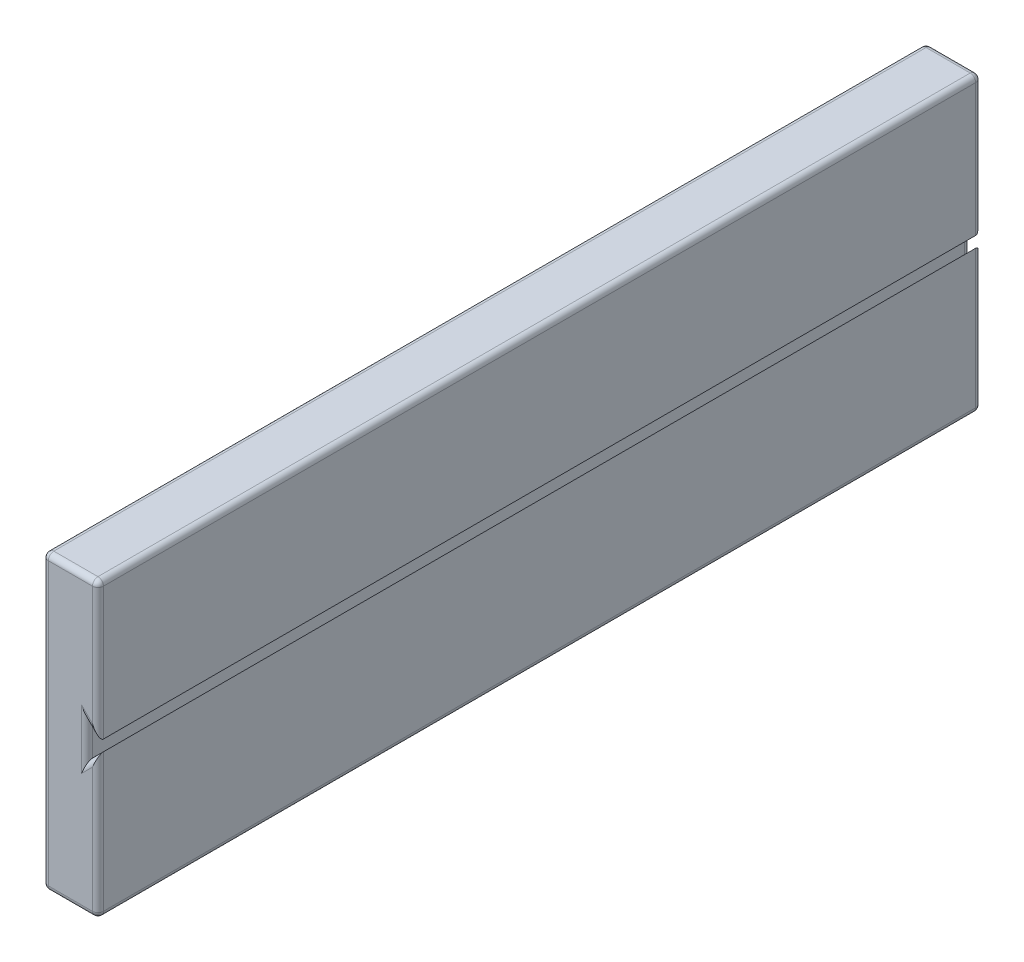
from build123d import *

# Parameters (mm, degrees)
SKETCH1_W               = 160
SKETCH1_H               = 53
BOSS_EXTRUDE1_DEPTH     = 10
CUT_EXTRUDE2_DEPTH      = 169.846083757
CUT_EXTRUDE2_DEPTH_BACK = 169.846083757
FILLET1_R               = 1


with BuildPart() as part:
    # Sketch1 → Boss-Extrude1 (new body)
    with BuildSketch(Plane(origin=(0, 0, 0), x_dir=(0, 0, -1), z_dir=(1, 0, 0))):
        with Locations((80, 26.5)):
            Rectangle(SKETCH1_W, SKETCH1_H)
    extrude(amount=BOSS_EXTRUDE1_DEPTH)

    # Sketch4 → Cut-Extrude2 (cut, two sides: drawn at the far end of the back side and taken through both)
    with BuildSketch(Plane.XY.offset(-CUT_EXTRUDE2_DEPTH_BACK)):
        Polygon((59.152546933, 75.177989704), (10, 26.025442771), (8, 24.025442771), (8, 30.025442771), (10, 28.025442771), (59.152546933, -21.127104162), (-79.871850062, -21.127104162), (-79.871850062, 75.177989704), align=None)
    extrude(amount=CUT_EXTRUDE2_DEPTH + CUT_EXTRUDE2_DEPTH_BACK, mode=Mode.SUBTRACT)

    # Fillet1
    fillet1_edges = [part.edges().sort_by_distance(p)[0] for p in [
        (10, 0, -80),
        (0, 0, -80),
        (9, 29.025442771, -160),
        (10, 40.512721385, -160),
        (0, 26.5, -160),
        (5, 0, -160),
        (10, 13.012721385, -160),
        (9, 25.025442771, -160),
        (8, 27.025442771, -160),
        (5, 0, 0),
        (0, 26.5, 0),
        (10, 40.512721385, 0),
        (9, 29.025442771, 0),
        (8, 27.025442771, 0),
        (9, 25.025442771, 0),
        (10, 13.012721385, 0),
        (5, 53, -160),
        (10, 53, -80),
        (5, 53, 0),
        (0, 53, -80),
    ]]
    fillet(fillet1_edges, radius=FILLET1_R)


solid = part.part
